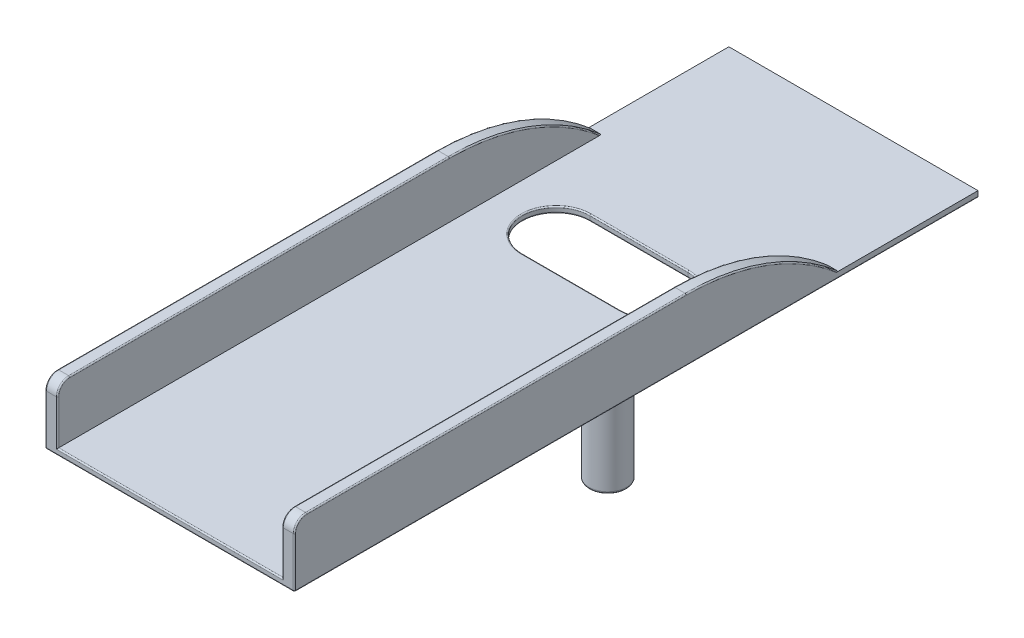
from build123d import *

# Parameters (mm, degrees)
SKETCH1_R             = 3.8735
SKETCH1_R_2           = 2.032
BOSS_EXTRUDE1_DEPTH   = 25.9842
BOSS_EXTRUDE1_2_DEPTH = 25.9842
SKETCH2_W             = 51.6128
SKETCH2_H             = 144.145
BOSS_EXTRUDE2_DEPTH   = 1.27
SKETCH2_3_W           = 51.6128
SKETCH2_3_H           = 144.145
SKETCH2_3_W_2         = 46.5328
SKETCH2_3_H_2         = 139.065
BOSS_EXTRUDE3_DEPTH   = 12.954
SKETCH5_W             = 51.6128
SKETCH5_H             = 11.684
CUT_EXTRUDE1_DEPTH    = 28.956
FILLET1_R             = 48.26
FILLET2_R             = 2.54
SKETCH6_W             = 51.6128
SKETCH6_H             = 12.954
CUT_EXTRUDE2_DEPTH    = 44.196
FILLET3_R             = 2.54
CUT_EXTRUDE3_DEPTH    = 16.256
FILLET4_R             = 0.254
FILLET5_R             = 0.254
FILLET6_R             = 0.254
FILLET7_R             = 0.508


with BuildPart() as part:
    # Sketch1 → Boss-Extrude1 (new body)
    with BuildSketch(Plane(origin=(0, 0, 0), x_dir=(1, 0, 0), z_dir=(0, 1, 0))):
        with Locations(Location((-11.96975, 0, 0), (0, 0, 270))):
            Circle(SKETCH1_R)
        with Locations(Location((-11.96975, 0, 0), (0, 0, 270))):
            Circle(SKETCH1_R_2, mode=Mode.SUBTRACT)
    extrude(amount=BOSS_EXTRUDE1_DEPTH)



with BuildPart() as body_2:
    # Sketch1 → Boss-Extrude1 2 (new body)
    with BuildSketch(Plane(origin=(0, 0, 0), x_dir=(1, 0, 0), z_dir=(0, 1, 0))):
        with Locations(Location((11.96975, 0, 0), (0, 0, 270))):
            Circle(SKETCH1_R)
        with Locations(Location((11.96975, 0, 0), (0, 0, 270))):
            Circle(SKETCH1_R_2, mode=Mode.SUBTRACT)
    extrude(amount=BOSS_EXTRUDE1_2_DEPTH)


with BuildPart() as part_1:
    add(part.part)

    add(body_2.part)  # Boss-Extrude2 merges body 2
    # Sketch2 → Boss-Extrude2 (add)
    with BuildSketch(Plane(origin=(0, 25.9842, 0), x_dir=(1, 0, 0), z_dir=(0, 1, 0))):
        with Locations((-0.0381, -9.1821)):
            Rectangle(SKETCH2_W, SKETCH2_H)
    extrude(amount=BOSS_EXTRUDE2_DEPTH)

    # Sketch2<3> → Boss-Extrude3 (add)
    with BuildSketch(Plane(origin=(0, 25.9842, 0), x_dir=(1, 0, 0), z_dir=(0, 1, 0))):
        with Locations((-0.0381, -9.1821)):
            Rectangle(SKETCH2_3_W, SKETCH2_3_H)
        with Locations((-0.0381, -9.1821)):
            Rectangle(SKETCH2_3_W_2, SKETCH2_3_H_2, mode=Mode.SUBTRACT)
    extrude(amount=BOSS_EXTRUDE3_DEPTH)

    # Sketch5 → Cut-Extrude1 (cut)
    with BuildSketch(Plane(origin=(0, 0, -62.8904), x_dir=(-1, 0, 0), z_dir=(0, 0, -1))):
        with Locations((0.0381, 33.0962)):
            Rectangle(SKETCH5_W, SKETCH5_H)
    extrude(amount=-CUT_EXTRUDE1_DEPTH, mode=Mode.SUBTRACT)

    # Fillet1
    # the kernel refuses this fillet: 48.26 mm, written as the material it takes off along each edge
    with BuildSketch(Plane(origin=(-55.480968196, 38.9382, -33.9344), x_dir=(0, 0, 1), z_dir=(1, 0, 0)), Plane(origin=(-104.553768196, 38.9382, -33.9344), x_dir=(0, 0, 1), z_dir=(1, 0, 0))) as fillet1_piece_1:
        with BuildLine():
            CenterArc((31.483707279, 48.26), FILLET1_R, 229.278952408, 40.721047592)
            Line((0, 11.684), (-0.629674146, 10.95248))
            ThreePointArc((-0.629674146, 10.95248), (-0.9652, 5.842), (-0.9652, 0))
            Line((-0.9652, 0), (0, -0.9652))
            Line((0, -0.9652), (31.483707279, -0.9652))
            Line((31.483707279, -0.9652), (31.483707279, 0))
        make_face()
    extrude(amount=159.958536393, mode=Mode.SUBTRACT)

    # Fillet2
    fillet2_edges = [part_1.edges().sort_by_distance(p)[0] for p in [
        (-25.8445, 32.4612, 81.2546),
        (25.7683, 32.4612, 81.2546),
    ]]
    fillet(fillet2_edges, radius=FILLET2_R)

    # Sketch6 → Cut-Extrude2 (cut)
    with BuildSketch(Plane(origin=(0, 0, 78.7146), x_dir=(-1, 0, 0), z_dir=(0, 0, -1))):
        with Locations((0.0381, 32.4612)):
            Rectangle(SKETCH6_W, SKETCH6_H)
    extrude(amount=-CUT_EXTRUDE2_DEPTH, mode=Mode.SUBTRACT)

    # Fillet3
    fillet3_edges = [part_1.edges().sort_by_distance(p)[0] for p in [
        (24.4983, 38.9382, 78.7146),
        (-24.5745, 38.9382, 78.7146),
    ]]
    fillet(fillet3_edges, radius=FILLET3_R)

    # Sketch7 → Cut-Extrude3 (cut)
    with BuildSketch(Plane.XZ.offset(-25.9842)):
        with BuildLine():
            Line((-10.16, -4.445), (10.16, -4.445))
            ThreePointArc((10.16, -4.445), (17.145, -11.43), (10.16, -18.415))
            Line((10.16, -18.415), (-10.16, -18.415))
            ThreePointArc((-10.16, -18.415), (-17.145, -11.43), (-10.16, -4.445))
        make_face()
    extrude(amount=-CUT_EXTRUDE3_DEPTH, mode=Mode.SUBTRACT)

    # Fillet4
    fillet4_edges = [part_1.edges().sort_by_distance(p)[0] for p in [
        (-25.8445, 31.1912, 78.7146),
        (-0.0381, 25.9842, 78.7146),
        (-23.3045, 31.8262, 78.7146),
        (-23.3045, 38.194251224, 77.970651224),
        (25.7683, 31.1912, 78.7146),
        (23.2283, 31.8262, 78.7146),
        (-25.8445, 38.194251224, 77.970651224),
        (23.2283, 38.9382, 36.861953639),
        (25.7683, 38.9382, 36.861953639),
        (25.7683, 38.194251224, 77.970651224),
        (23.2283, 38.194251224, 77.970651224),
        (-0.0381, 27.2542, 78.7146),
        (25.7683, 35.923008321, -19.241610505),
        (-23.3045, 38.9382, 36.861953639),
        (-25.8445, 38.9382, 36.861953639),
        (23.2283, 35.923008321, -19.241610505),
        (-23.3045, 35.923008321, -19.241610505),
        (-25.8445, 35.923008321, -19.241610505),
    ]]
    fillet(fillet4_edges, radius=FILLET4_R)

    # Fillet5
    # the kernel refuses this fillet: 0.254 mm, written as the material it adds along each edge
    with BuildSketch(Plane(origin=(11.96975, 25.9842, 0), x_dir=(0, 0, 1), z_dir=(-1, 0, 0))) as fillet5_piece_1:
        with BuildLine():
            CenterArc((3.8735 + FILLET5_R, -FILLET5_R), FILLET5_R, 90, 90)
            Line((3.8735, -FILLET5_R), (3.8735, 0))
            Line((3.8735, 0), (3.8735 + FILLET5_R, 0))
        make_face()
    revolve(axis=Axis((11.96975, 25.9842, 0), (0, 1, 0)))
    with BuildSketch(Plane(origin=(-11.96975, 25.9842, 0), x_dir=(0, 0, 1), z_dir=(-1, 0, 0))) as fillet5_piece_2:
        with BuildLine():
            CenterArc((3.8735 + FILLET5_R, -FILLET5_R), FILLET5_R, 90, 90)
            Line((3.8735, -FILLET5_R), (3.8735, 0))
            Line((3.8735, 0), (3.8735 + FILLET5_R, 0))
        make_face()
    revolve(axis=Axis((-11.96975, 25.9842, 0), (0, 1, 0)))
    # the kernel refuses this fillet: 0.254 mm, written as the material it takes off along each edge
    with BuildSketch(Plane(origin=(-25.5905, 26.2382, 78.4606), x_dir=(0, -1, 0), z_dir=(-1, 0, 0))) as fillet5_2_piece_1_section:
        Polygon((0, 0), (FILLET5_R * 1.02, 0), (FILLET5_R * 1.02, FILLET5_R * 1.02), (0, FILLET5_R * 1.02), align=None)
    fillet5_2_piece_1 = extrude(amount=FILLET5_R * 1.02, mode=Mode.PRIVATE)
    fillet5_2_piece_1 = fillet5_2_piece_1 - Plane(origin=(-25.5905, 26.2382, 78.4606), x_dir=(0, 0.7071067811865475, -0.7071067811865475), z_dir=(-1, 0, 0)) * Sphere(FILLET5_R, mode=Mode.PRIVATE)
    add(fillet5_2_piece_1, mode=Mode.SUBTRACT)
    with BuildSketch(Plane(origin=(25.5143, 26.2382, 78.4606), x_dir=(1, 0, 0), z_dir=(0, -1, 0))) as fillet5_2_piece_2_section:
        Polygon((0, 0), (FILLET5_R * 1.02, 0), (FILLET5_R * 1.02, FILLET5_R * 1.02), (0, FILLET5_R * 1.02), align=None)
    fillet5_2_piece_2 = extrude(amount=FILLET5_R * 1.02, mode=Mode.PRIVATE)
    fillet5_2_piece_2 = fillet5_2_piece_2 - Plane(origin=(25.5143, 26.2382, 78.4606), x_dir=(-0.7071067811865476, 0, -0.7071067811865475), z_dir=(0, -1, 0)) * Sphere(FILLET5_R, mode=Mode.PRIVATE)
    add(fillet5_2_piece_2, mode=Mode.SUBTRACT)
    with BuildSketch(Plane(origin=(-25.8445, 25.9842, -63.5254), x_dir=(0, 1, 0), z_dir=(0, 0, 1))) as fillet5_2_piece_3:
        with BuildLine():
            CenterArc((FILLET5_R, -FILLET5_R), FILLET5_R, 90, 90)
            Line((0, -FILLET5_R), (0, 0))
            Line((0, 0), (FILLET5_R, 0))
        make_face()
    extrude(amount=141.986, mode=Mode.SUBTRACT)
    with BuildSketch(Plane(origin=(26.4033, 25.9842, -62.8904), x_dir=(0, 0, 1), z_dir=(-1, 0, 0))) as fillet5_2_piece_4:
        with BuildLine():
            CenterArc((FILLET5_R, FILLET5_R), FILLET5_R, 180, 90)
            Line((0, FILLET5_R), (0, 0))
            Line((0, 0), (FILLET5_R, 0))
        make_face()
    extrude(amount=52.8828, mode=Mode.SUBTRACT)
    with BuildSketch(Plane(origin=(25.7683, 25.9842, 78.4606), x_dir=(-1, 0, 0), z_dir=(0, 0, -1))) as fillet5_2_piece_5:
        with BuildLine():
            CenterArc((FILLET5_R, FILLET5_R), FILLET5_R, 180, 90)
            Line((0, FILLET5_R), (0, 0))
            Line((0, 0), (FILLET5_R, 0))
        make_face()
    extrude(amount=141.986, mode=Mode.SUBTRACT)
    with BuildSketch(Plane(origin=(-10.16, 25.9842, -11.43), x_dir=(0, 0, -1), z_dir=(1, 0, 0))) as fillet5_2_piece_6:
        with BuildLine():
            CenterArc((6.985 + FILLET5_R, FILLET5_R), FILLET5_R, 180, 90)
            Line((6.985, FILLET5_R), (6.985, 0))
            Line((6.985, 0), (6.985 + FILLET5_R, 0))
        make_face()
    revolve(axis=Axis((-10.16, 25.9842, -11.43), (0, 1, 0)), revolution_arc=180, mode=Mode.SUBTRACT)
    with BuildSketch(Plane(origin=(10.16, 25.9842, -18.415), x_dir=(0, 0, -1), z_dir=(-1, 0, 0)), Plane(origin=(-10.16, 25.9842, -4.445), x_dir=(0, 0, 1), z_dir=(1, 0, 0))) as fillet5_2_piece_7:
        with BuildLine():
            CenterArc((FILLET5_R, -FILLET5_R), FILLET5_R, 90, 90)
            Line((0, -FILLET5_R), (0, 0))
            Line((0, 0), (FILLET5_R, 0))
        make_face()
    extrude(amount=20.32, mode=Mode.SUBTRACT)
    with BuildSketch(Plane(origin=(10.16, 25.9842, -11.43), x_dir=(0, 0, 1), z_dir=(-1, 0, 0))) as fillet5_2_piece_8:
        with BuildLine():
            CenterArc((6.985 + FILLET5_R, FILLET5_R), FILLET5_R, 180, 90)
            Line((6.985, FILLET5_R), (6.985, 0))
            Line((6.985, 0), (6.985 + FILLET5_R, 0))
        make_face()
    revolve(axis=Axis((10.16, 25.9842, -11.43), (0, 1, 0)), revolution_arc=180, mode=Mode.SUBTRACT)

    # Fillet6
    fillet6_edges = [part_1.edges().sort_by_distance(p)[0] for p in [
        (0, 27.2542, -18.415),
        (17.145, 27.2542, -11.43),
        (0, 27.2542, -4.445),
        (-17.145, 27.2542, -11.43),
    ]]
    fillet(fillet6_edges, radius=FILLET6_R)

    # Fillet7
    fillet7_edges = [part_1.edges().sort_by_distance(p)[0] for p in [
        (-11.96975, 0, -3.8735),
        (11.96975, 0, -3.8735),
    ]]
    fillet(fillet7_edges, radius=FILLET7_R)


solid = part_1.part
